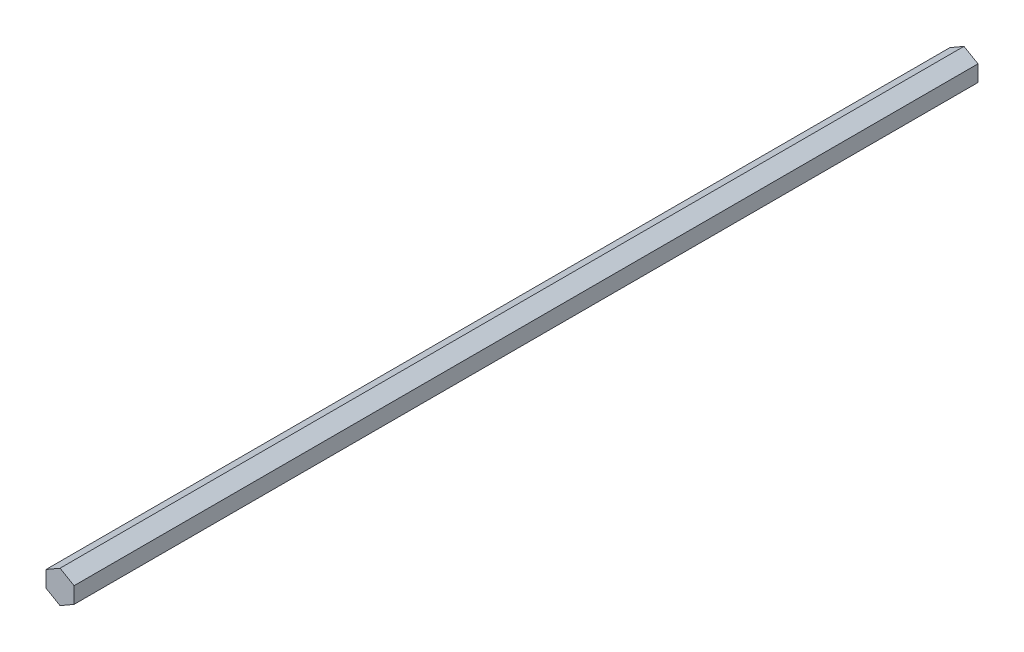
from build123d import *

# Parameters (mm, degrees)
BOSS_EXTRUDE1_DEPTH = 204.47


with BuildPart() as part:
    # Sketch1 → Boss-Extrude1 (new, symmetric)
    with BuildSketch(Plane.XY):
        Polygon((0, -7.332348419), (6.35, -3.666174209), (6.35, 3.666174209), (0, 7.332348419), (-6.35, 3.666174209), (-6.35, -3.666174209), align=None)
    extrude(amount=BOSS_EXTRUDE1_DEPTH, both=True)


solid = part.part
